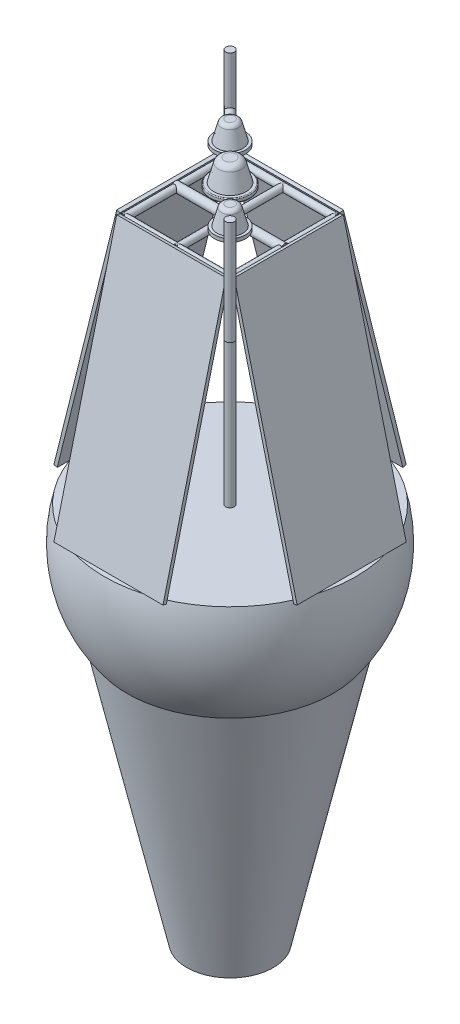
from build123d import *

# Parameters (mm, degrees)
SALIENTE_EXTRUIR1_DEPTH      = 315
MATRIZC13_COUNT              = 4
CROQUIS4_R                   = 20
SALIENTE_EXTRUIR15_DEPTH     = 315
CROQUIS5_R                   = 25
SALIENTE_EXTRUIR17_DEPTH     = 315
CROQUIS7_R                   = 25
SALIENTE_EXTRUIR18_DEPTH     = 600
SALIENTE_EXTRUIR19_START     = -300
SALIENTE_EXTRUIR19_OUTLINE_R = 25
SALIENTE_EXTRUIR19_DEPTH     = 600


# Read off the part's stored shape, not the designer's step: Saliente-Extruir19
with BuildPart() as part:
    # Croquis1 → Revolución1 (revolve)
    with BuildSketch(Plane.XY, mode=Mode.PRIVATE) as revoluci_n1_sk:
        with BuildLine():
            Line((25, 192.028643697), (725, 192.028643697))
            ThreePointArc((725, 192.028643697), (735.27143721, -147.905083156), (594.357418887, -457.426779511))
            Line((594.357418887, -457.426779511), (250, -2000))
            Line((250, -2000), (0, -2000))
            Line((0, -2000), (0, 1742.028643697))
            Line((0, 1742.028643697), (25, 1742.028643697))
            Line((25, 1742.028643697), (25, 192.028643697))
        make_face()
    revolve(revoluci_n1_sk.sketch.rotate(Axis((0, 1742.028643697, 0), (0, -1, 0)), 180), axis=Axis((0, 1742.028643697, 0), (0, -1, 0)))

    # Croquis7 → Saliente-Extruir18 (add, symmetric)
    with BuildSketch(Plane(origin=(-7.3421e-05, 0, -7.3421e-05), x_dir=(0.7071067811865475, 0, -0.7071067811865476), z_dir=(0.7071067811865464, -5.960464483662303e-08, 0.7071067811865462))):
        with Locations((0, 1742.028643697)):
            Circle(CROQUIS7_R)
    extrude(amount=SALIENTE_EXTRUIR18_DEPTH, both=True)

    # Saliente-Extruir19 outline → Saliente-Extruir19 (add)
    with BuildSketch(Plane(origin=(-1096.015503544, 1742.03, 1096.015503544), x_dir=(0.7071067811865472, 0, 0.7071067811865478), z_dir=(0, 1, 0)).offset(SALIENTE_EXTRUIR19_START)):
        with Locations((600, 1549.999989683)):
            Circle(SALIENTE_EXTRUIR19_OUTLINE_R)
        with Locations((-600, 1549.999989683)):
            Circle(SALIENTE_EXTRUIR19_OUTLINE_R)
    extrude(amount=SALIENTE_EXTRUIR19_DEPTH)

    # Croquis11 → Revolución2 (revolve)
    with BuildSketch(Plane(origin=(7.3421e-05, 0, -7.3421e-05), x_dir=(0.7071067811865475, 0, 0.7071067811865477), z_dir=(-0.7071067811865465, -5.960464483662305e-08, 0.7071067811865462)), mode=Mode.PRIVATE) as revoluci_n2_sk:
        with BuildLine():
            Line((304, 1797.028679459), (304, 1887.028679459))
            Line((304, 1887.028679459), (300, 1887.028679459))
            Line((300, 1887.028679459), (300, 1742.028679459))
            Line((300, 1742.028679459), (310, 1742.028679459))
            Line((310, 1742.028679459), (310, 1777.028679459))
            Line((310, 1777.028679459), (390, 1777.028679459))
            Line((390, 1777.028679459), (390, 1797.028679459))
            Line((390, 1797.028679459), (374.474411167, 1797.028679459))
            Line((374.474411167, 1797.028679459), (349.964970958, 1888.499155587))
            ThreePointArc((349.964970958, 1888.499155587), (341.035861026, 1901.862512967), (325.816825301, 1907.028679459))
            Line((325.816825301, 1907.028679459), (300, 1907.028679459))
            Line((300, 1907.028679459), (300, 1902.028679459))
            Line((300, 1902.028679459), (325.816825301, 1902.028679459))
            ThreePointArc((325.816825301, 1902.028679459), (337.992053881, 1897.895746265), (345.135341826, 1887.205060362))
            Line((345.135341826, 1887.205060362), (369.298030265, 1797.028679459))
            Line((369.298030265, 1797.028679459), (304, 1797.028679459))
        make_face()
    revoluci_n2 = revolve(revoluci_n2_sk.sketch.rotate(Axis((212.132034356, 1742.02867946, 212.132034356), (-4.214684846917248e-08, 0.9999999999999982, 4.214684846917248e-08)), 135), axis=Axis((212.132034356, 1742.02867946, 212.132034356), (-4.214684846917248e-08, 0.9999999999999982, 4.214684846917248e-08)))

    # Croquis13 → Revolución4 (revolve)
    with BuildSketch(Plane(origin=(7.3421e-05, 0, -7.3421e-05), x_dir=(0.7071067811865475, 0, 0.7071067811865477), z_dir=(-0.7071067811865465, -5.960464483662305e-08, 0.7071067811865462)), mode=Mode.PRIVATE) as revoluci_n4_sk:
        with BuildLine():
            Line((300, 1844.528679459), (307, 1844.528679459))
            ThreePointArc((307, 1844.528679459), (310.222712922, 1866.554580804), (318.534385596, 1887.205060362))
            ThreePointArc((318.534385596, 1887.205060362), (312.473830718, 1864.977261348), (310.432271585, 1842.028679459))
            Line((310.432271585, 1842.028679459), (300, 1842.028679459))
            Line((300, 1842.028679459), (300, 1844.528679459))
        make_face()
    revoluci_n4 = revolve(revoluci_n4_sk.sketch.rotate(Axis((219.508760122, 1842.02867946, 219.508768552), (-0.7071067811865462, 0, -0.7071067811865489)), 90.000003415), axis=Axis((219.508760122, 1842.02867946, 219.508768552), (-0.7071067811865462, 0, -0.7071067811865489)))

    # Simetría1: Revolución2, Revolución4 across plane
    add(revoluci_n2.mirror(Plane(origin=(-7.3421e-05, 0, -7.3421e-05), x_dir=(-0.7071067811865437, 5.960464483662281e-08, 0.7071067811865487), z_dir=(0.7071067811865464, -5.960464483662303e-08, 0.7071067811865462))))
    add(revoluci_n4.mirror(Plane(origin=(-7.3421e-05, 0, -7.3421e-05), x_dir=(-0.7071067811865437, 5.960464483662281e-08, 0.7071067811865487), z_dir=(0.7071067811865464, -5.960464483662303e-08, 0.7071067811865462))))


with BuildPart() as body_2:
    # Croquis3 → Saliente-Extruir1 (new, symmetric)
    with BuildSketch(Plane.XY):
        with BuildLine():
            Line((339.405914526, 1652.310671023), (320, 1647.472233111))
            Line((320, 1647.472233111), (322.570592517, 1637.162149654))
            Line((322.570592517, 1637.162149654), (321.954373936, 1637.008509106))
            ThreePointArc((321.954373936, 1637.008509106), (284.968372944, 1622.633795199), (324.373592892, 1627.305551843))
            Line((324.373592892, 1627.305551843), (324.989811473, 1627.459192391))
            Line((324.989811473, 1627.459192391), (682.882843399, 192.028643697))
            Line((682.882843399, 192.028643697), (702.288757925, 196.867081609))
            Line((702.288757925, 196.867081609), (339.405914526, 1652.310671023))
        make_face()
    extrude(amount=SALIENTE_EXTRUIR1_DEPTH, both=True)


with BuildPart() as matrizc13_1:
    # MatrizC13: pattern copy
    add(body_2.part.rotate(Axis((0, 0, 0), (0, 1, 0)), 1 * 360 / MATRIZC13_COUNT))


with BuildPart() as matrizc13_2:
    # MatrizC13: pattern copy
    add(body_2.part.rotate(Axis((0, 0, 0), (0, 1, 0)), 2 * 360 / MATRIZC13_COUNT))


with BuildPart() as matrizc13_3:
    # MatrizC13: pattern copy
    add(body_2.part.rotate(Axis((0, 0, 0), (0, 1, 0)), 3 * 360 / MATRIZC13_COUNT))


with BuildPart() as body_6:
    # Croquis4 → Saliente-Extruir15 (new, symmetric)
    with BuildSketch(Plane.XY):
        with Locations((0, 1627.459192391)):
            Circle(CROQUIS4_R)
    extrude(amount=SALIENTE_EXTRUIR15_DEPTH, both=True)


with BuildPart() as body_7:
    # Croquis5 → Saliente-Extruir17 (new, symmetric)
    with BuildSketch(Plane(origin=(0, 0, 0), x_dir=(0, 0, -1), z_dir=(1, 0, 0))):
        with Locations((0, 1627.459192391)):
            Circle(CROQUIS5_R)
    extrude(amount=SALIENTE_EXTRUIR17_DEPTH, both=True)


with BuildPart() as body_8:
    # Croquis12 → Revolución3 (revolve)
    with BuildSketch(Plane(origin=(7.3421e-05, 0, -7.3421e-05), x_dir=(0.7071067811865475, 0, 0.7071067811865477), z_dir=(-0.7071067811865465, -5.960464483662305e-08, 0.7071067811865462)), mode=Mode.PRIVATE) as revoluci_n3_sk:
        with BuildLine():
            Line((0, 1927.02867946), (-33.143552106, 1927.028683411))
            ThreePointArc((-33.143552106, 1927.028683411), (-54.450204639, 1919.796051591), (-66.950960199, 1901.087349989))
            Line((-66.950960199, 1901.087349989), (-93.493647984, 1802.028690605))
            Line((-93.493647984, 1802.028690605), (-109.999999404, 1802.028692573))
            ThreePointArc((-109.999999404, 1802.028692573), (-113.535533695, 1800.564226689), (-115, 1797.028692573))
            Line((-115, 1797.028692573), (-115, 1782.028692573))
            ThreePointArc((-115, 1782.028692573), (-113.535534117, 1778.493158877), (-110.000000596, 1777.028692573))
            Line((-110.000000596, 1777.028692573), (-15, 1777.028681248))
            Line((-15, 1777.028681248), (-15, 1767.028644591))
            Line((-15, 1767.028644591), (0, 1767.028643697))
            Line((0, 1767.028643697), (0, 1927.02867946))
        make_face()
    revolve(revoluci_n3_sk.sketch.rotate(Axis((1.054e-06, 1717.028643697, -1.054e-06), (-4.214684855419187e-08, 0.9999999999999983, 4.214684855419187e-08)), 315), axis=Axis((1.054e-06, 1717.028643697, -1.054e-06), (-4.214684855419187e-08, 0.9999999999999983, 4.214684855419187e-08)))


solid = Compound([part.part, body_2.part, matrizc13_1.part, matrizc13_2.part, matrizc13_3.part, body_6.part, body_7.part, body_8.part])
